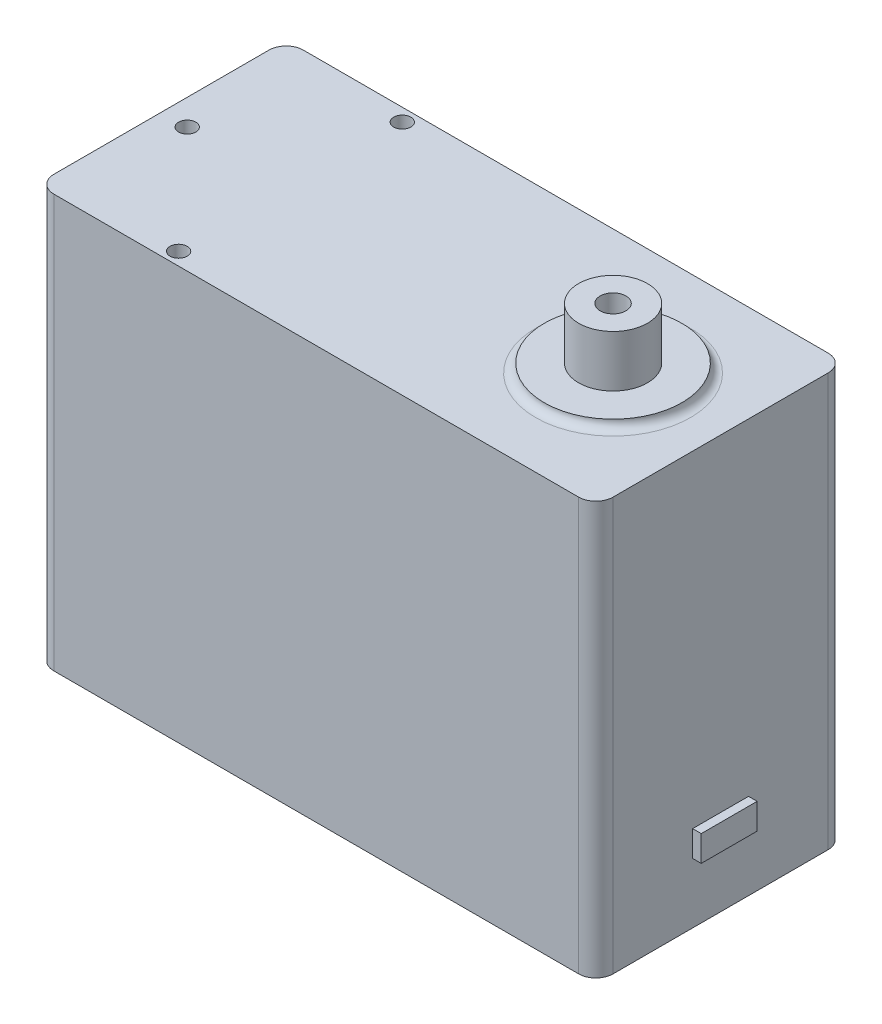
from build123d import *

# Parameters (mm, degrees)
SKETCH_2_W          = 65
SKETCH_2_H          = 29
EXTRUDE_1_DEPTH     = 24
FILLET_1_R          = 2
SKETCH_3_R          = 1
CUT_EXTRUDE_1_DEPTH = 6
SKETCH_4_R          = 8
EXTRUDE_2_DEPTH     = 1
FILLET_2_R          = 1
SKETCH_5_R          = 4
EXTRUDE_3_DEPTH     = 6
SKETCH_6_R          = 1
CUT_EXTRUDE_2_DEPTH = 6
EXTRUDE_START       = 1
SKETCH_7_R          = 8
EXTRUDE_4_DEPTH     = 1
FILLET_3_R          = 1
SKETCH_8_R          = 3.5
EXTRUDE_5_DEPTH     = 0.3
SKETCH_9_R          = 3
EXTRUDE_6_DEPTH     = 5.5
SKETCH_10_R         = 1
CUT_EXTRUDE_3_DEPTH = 5.5
SKETCH_11_W         = 6.5
SKETCH_11_H         = 3
EXTRUDE_7_DEPTH     = 1
SKETCH_12_R         = 1.5
CUT_EXTRUDE_4_DEPTH = 6


with BuildPart() as part:
    # ｽｹｯﾁ2 → ﾎﾞｽ - 押し出し1 (new, symmetric)
    with BuildSketch(Plane(origin=(0, 0, 0), x_dir=(1, 0, 0), z_dir=(0, 1, 0))):
        Rectangle(SKETCH_2_W, SKETCH_2_H)
    extrude(amount=EXTRUDE_1_DEPTH, both=True)

    # ﾌｨﾚｯﾄ1
    fillet_1_edges = [part.edges().sort_by_distance(p)[0] for p in [
        (32.5, 0, 14.5),
        (-32.5, 0, 14.5),
        (-32.5, 0, -14.5),
        (32.5, 0, -14.5),
    ]]
    fillet(fillet_1_edges, radius=FILLET_1_R)

    # ｽｹｯﾁ3 → ｶｯﾄ - 押し出し1 (cut)
    with BuildSketch(Plane(origin=(0, 24, 0), x_dir=(1, 0, 0), z_dir=(0, 1, 0))):
        with Locations(Location((-29.5, 0, 0), (0, 0, 270))):
            Circle(SKETCH_3_R)
        with Locations(Location((-17.5, -13, 0), (0, 0, 270))):
            Circle(SKETCH_3_R)
        with Locations(Location((-17.5, 13, 0), (0, 0, 90))):
            Circle(SKETCH_3_R)
    extrude(amount=-CUT_EXTRUDE_1_DEPTH, mode=Mode.SUBTRACT)

    # ｽｹｯﾁ4 → ﾎﾞｽ - 押し出し2 (add)
    with BuildSketch(Plane(origin=(0, 24, 0), x_dir=(1, 0, 0), z_dir=(0, 1, 0))):
        with Locations(Location((20, 0, 0), (0, 0, 270))):
            Circle(SKETCH_4_R)
    extrude(amount=EXTRUDE_2_DEPTH)

    # ﾌｨﾚｯﾄ2
    fillet_2_edges = [part.edges().sort_by_distance(p)[0] for p in [
        (20, 24, -8),
    ]]
    fillet(fillet_2_edges, radius=FILLET_2_R - 0.0001)  # a hair under: the kernel refuses the full size

    # ｽｹｯﾁ5 → ﾎﾞｽ - 押し出し3 (add)
    with BuildSketch(Plane(origin=(0, 25, 0), x_dir=(1, 0, 0), z_dir=(0, 1, 0))):
        with Locations(Location((20, 0, 0), (0, 0, 270))):
            Circle(SKETCH_5_R)
    extrude(amount=EXTRUDE_3_DEPTH)

    # ｽｹｯﾁ6 → ｶｯﾄ - 押し出し2 (cut)
    with BuildSketch(Plane.XZ.offset(24)):
        with Locations(Location((-29.5, 13, 0), (0, 0, 270))):
            Circle(SKETCH_6_R)
        with Locations(Location((-29.5, -13, 0), (0, 0, 90))):
            Circle(SKETCH_6_R)
        with Locations(Location((29.5, -13, 0), (0, 0, 270))):
            Circle(SKETCH_6_R)
        with Locations(Location((29.5, 13, 0), (0, 0, 90))):
            Circle(SKETCH_6_R)
        with Locations(Location((-5.5, 13, 0), (0, 0, 270))):
            Circle(SKETCH_6_R)
        with Locations(Location((-5.5, -13, 0), (0, 0, 90))):
            Circle(SKETCH_6_R)
    extrude(amount=-CUT_EXTRUDE_2_DEPTH, mode=Mode.SUBTRACT)

    # ｽｹｯﾁ7 → ﾎﾞｽ - 押し出し4 (add)
    with BuildSketch(Plane.XZ.offset(24).offset(EXTRUDE_START)):
        with Locations(Location((20, 0, 0), (0, 0, 90))):
            Circle(SKETCH_7_R)
    extrude(amount=-EXTRUDE_4_DEPTH)

    # ﾌｨﾚｯﾄ3
    fillet_3_edges = [part.edges().sort_by_distance(p)[0] for p in [
        (20, -24, -8),
    ]]
    fillet(fillet_3_edges, radius=FILLET_3_R - 0.0001)  # a hair under: the kernel refuses the full size

    # ｽｹｯﾁ8 → ﾎﾞｽ - 押し出し5 (add)
    with BuildSketch(Plane.XZ.offset(25)):
        with Locations(Location((20, 0, 0), (0, 0, 270))):
            Circle(SKETCH_8_R)
    extrude(amount=EXTRUDE_5_DEPTH)

    # ｽｹｯﾁ9 → ﾎﾞｽ - 押し出し6 (add)
    with BuildSketch(Plane.XZ.offset(25)):
        with Locations(Location((20, 0, 0), (0, 0, 270))):
            Circle(SKETCH_9_R)
    extrude(amount=EXTRUDE_6_DEPTH)

    # ｽｹｯﾁ10 → ｶｯﾄ - 押し出し3 (cut)
    with BuildSketch(Plane.XZ.offset(30.5)):
        with Locations(Location((20, 0, 0), (0, 0, 270))):
            Circle(SKETCH_10_R)
    extrude(amount=-CUT_EXTRUDE_3_DEPTH, mode=Mode.SUBTRACT)

    # ｽｹｯﾁ11 → ﾎﾞｽ - 押し出し7 (add)
    with BuildSketch(Plane(origin=(32.5, 0, 0), x_dir=(0, 0, -1), z_dir=(1, 0, 0))):
        with Locations((0, -15.5)):
            Rectangle(SKETCH_11_W, SKETCH_11_H)
    extrude(amount=EXTRUDE_7_DEPTH)

    # ｽｹｯﾁ12 → ｶｯﾄ - 押し出し4 (cut)
    with BuildSketch(Plane(origin=(0, 31, 0), x_dir=(1, 0, 0), z_dir=(0, 1, 0))):
        with Locations(Location((20, 0, 0), (0, 0, 270))):
            Circle(SKETCH_12_R)
    extrude(amount=-CUT_EXTRUDE_4_DEPTH, mode=Mode.SUBTRACT)


solid = part.part
